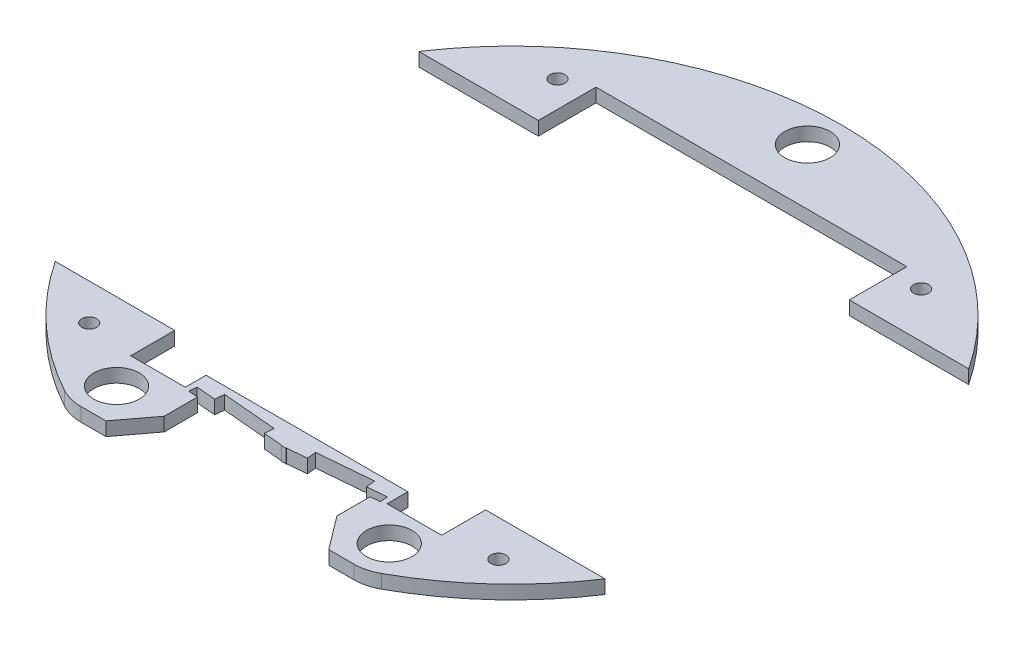
from build123d import *

# Parameters (mm, degrees)
BOSS_EXTRUDE1_DEPTH = 3
CUT_EXTRUDE1_DEPTH  = 103.574363269
SKETCH3_W           = 38.3
SKETCH3_H           = 80
CUT_EXTRUDE2_DEPTH  = 103.574363269
CUT_EXTRUDE3_DEPTH  = 95.453692358
SKETCH5_W           = 38
SKETCH5_H           = 14.605577538
CUT_EXTRUDE4_DEPTH  = 95.453692358
SKETCH6_W           = 68.4
SKETCH6_H           = 3
CUT_EXTRUDE5_DEPTH  = 95.453692358
SKETCH7_R           = 5
CUT_EXTRUDE6_DEPTH  = 95.453692358
SKETCH11_R          = 5
CUT_EXTRUDE10_DEPTH = 95.453692358
CUT_EXTRUDE11_DEPTH = 95.453692358
SKETCH14_R          = 1.65
CUT_EXTRUDE12_DEPTH = 95.453692358


with BuildPart() as part:
    # Sketch1 → Boss-Extrude1 (new body)
    with BuildSketch(Plane(origin=(0, 0, 0), x_dir=(1, 0, 0), z_dir=(0, 1, 0))):
        with BuildLine():
            Line((-30.029977361, -64.812867647), (30.029977361, -64.812867647))
            ThreePointArc((30.029977361, -64.812867647), (32.509837414, -64.500503794), (34.834773739, -63.582926471))
            ThreePointArc((34.834773739, -63.582926471), (0, 72.5), (-34.834773739, -63.582926471))
            ThreePointArc((-34.834773739, -63.582926471), (-32.509837414, -64.500503794), (-30.029977361, -64.812867647))
        make_face()
    extrude(amount=BOSS_EXTRUDE1_DEPTH)

    # Sketch2 → Cut-Extrude1 (cut, through all)
    with BuildSketch(Plane(origin=(0, 3, 0), x_dir=(1, 0, 0), z_dir=(0, 1, 0))):
        Polygon((22.2, -45.1), (22.2, -49.675685802), (34.2, -49.675685802), (34.2, 49.675685802), (22.2, 49.675685802), (22.2, 45.5), (-22.2, 45.5), (-22.2, 49.675685802), (-34.2, 49.675685802), (-34.2, -49.675685802), (-22.2, -49.675685802), (-22.2, -45.1), align=None)
    extrude(amount=-CUT_EXTRUDE1_DEPTH, mode=Mode.SUBTRACT)

    # Sketch3 → Cut-Extrude2 (cut, through all)
    with BuildSketch(Plane(origin=(0, 3, 0), x_dir=(1, 0, 0), z_dir=(0, 1, 0))):
        with Locations((-53.35, 0)):
            Rectangle(SKETCH3_W, SKETCH3_H)
        with Locations((53.35, 0)):
            Rectangle(SKETCH3_W, SKETCH3_H)
    extrude(amount=-CUT_EXTRUDE2_DEPTH, mode=Mode.SUBTRACT)


with BuildPart() as cut_extrude2_piece_1:
    # of the separate pieces the step leaves, piece 1, a body of its own (cut_extrude2_pieces)
    add(part.part.solids().sort_by_distance((60.466933112, 0, -40))[0])

    # Sketch6 → Cut-Extrude5 (cut, through all)
    with BuildSketch(Plane(origin=(0, 3, 0), x_dir=(1, 0, 0), z_dir=(0, 1, 0))):
        with Locations((0, 51.175685802)):
            Rectangle(SKETCH6_W, SKETCH6_H)
    extrude(amount=-CUT_EXTRUDE5_DEPTH, mode=Mode.SUBTRACT)


with BuildPart() as cut_extrude2_piece_2:
    # of the separate pieces the step leaves, piece 2, a body of its own (cut_extrude2_pieces)
    add(part.part.solids().sort_by_distance((-34.834773739, 0, 63.582926471))[0])

    # Sketch4 → Cut-Extrude3 (cut, through all)
    with BuildSketch(Plane(origin=(0, 3, 0), x_dir=(1, 0, 0), z_dir=(0, 1, 0))):
        Polygon((-21.070156074, -50.026174921), (-0.648164763, -51.812867647), (-0.5, -50.11933666), (-20.921991311, -48.332643934), align=None)
        Polygon((21.070156074, -50.026174921), (20.921991311, -48.332643934), (0.5, -50.11933666), (0.648164763, -51.812867647), align=None)
    extrude(amount=-CUT_EXTRUDE3_DEPTH, mode=Mode.SUBTRACT)

    # Sketch5 → Cut-Extrude4 (cut, through all)
    with BuildSketch(Plane(origin=(0, 3, 0), x_dir=(1, 0, 0), z_dir=(0, 1, 0))):
        with Locations((0, -57.510078878)):
            Rectangle(SKETCH5_W, SKETCH5_H)
        Polygon((16.688163844, -48.703055841), (4.733827467, -49.748924754), (4.559515981, -47.756535357), (16.513852358, -46.710666444), align=None)
        Polygon((-16.513852358, -46.710666444), (-4.559515981, -47.756535357), (-4.733827467, -49.748924754), (-16.688163844, -48.703055841), align=None)
    extrude(amount=-CUT_EXTRUDE4_DEPTH, mode=Mode.SUBTRACT)

    # Sketch7 → Cut-Extrude6 (cut, through all)
    with BuildSketch(Plane(origin=(0, 3, 0), x_dir=(1, 0, 0), z_dir=(0, 1, 0))):
        with Locations((-30, -57)):
            Circle(SKETCH7_R)
        with Locations((30, -57)):
            Circle(SKETCH7_R)
    extrude(amount=-CUT_EXTRUDE6_DEPTH, mode=Mode.SUBTRACT)

    # Sketch13 → Cut-Extrude11 (cut, through all)
    with BuildSketch(Plane(origin=(0, 3, 0), x_dir=(1, 0, 0), z_dir=(0, 1, 0))):
        Polygon((19, -57.510078878), (24.514988681, -64.812867647), (19, -64.812867647), align=None)
        Polygon((-19, -64.812867647), (-19, -57.510078878), (-24.514988681, -64.812867647), align=None)
    extrude(amount=-CUT_EXTRUDE11_DEPTH, mode=Mode.SUBTRACT)


with BuildPart() as cut_extrude5_kept_piece:
    # of the separate pieces the step leaves, the one the design keeps (cut_extrude5_pieces_kept)
    add(cut_extrude2_piece_1.part.solids().sort_by_distance((60.466933112, 0, -40))[0])

    # Sketch11 → Cut-Extrude10 (cut, through all)
    with BuildSketch(Plane(origin=(0, 3, 0), x_dir=(1, 0, 0), z_dir=(0, 1, 0))):
        with Locations((0, 65)):
            Circle(SKETCH11_R)
    extrude(amount=-CUT_EXTRUDE10_DEPTH, mode=Mode.SUBTRACT)


with BuildPart() as cut_extrude12_tool:
    # Sketch14 → Cut-Extrude12 (new, through all)
    with BuildSketch(Plane(origin=(0, 3, 0), x_dir=(1, 0, 0), z_dir=(0, 1, 0))):
        with Locations((45, -48)):
            Circle(SKETCH14_R)
        with Locations((-45, -48)):
            Circle(SKETCH14_R)
        with Locations((40, 50)):
            Circle(SKETCH14_R)
        with Locations((-40, 50)):
            Circle(SKETCH14_R)
    extrude(amount=-CUT_EXTRUDE12_DEPTH)


with BuildPart() as cut_extrude2_piece_2_1:
    add(cut_extrude2_piece_2.part)

    # Cut-Extrude12: cut by cut_extrude12_tool
    add(cut_extrude12_tool.part, mode=Mode.SUBTRACT)


with BuildPart() as cut_extrude5_kept_piece_1:
    add(cut_extrude5_kept_piece.part)

    # Cut-Extrude12: cut by cut_extrude12_tool
    add(cut_extrude12_tool.part, mode=Mode.SUBTRACT)


solid = Compound([cut_extrude2_piece_2_1.part, cut_extrude5_kept_piece_1.part])
